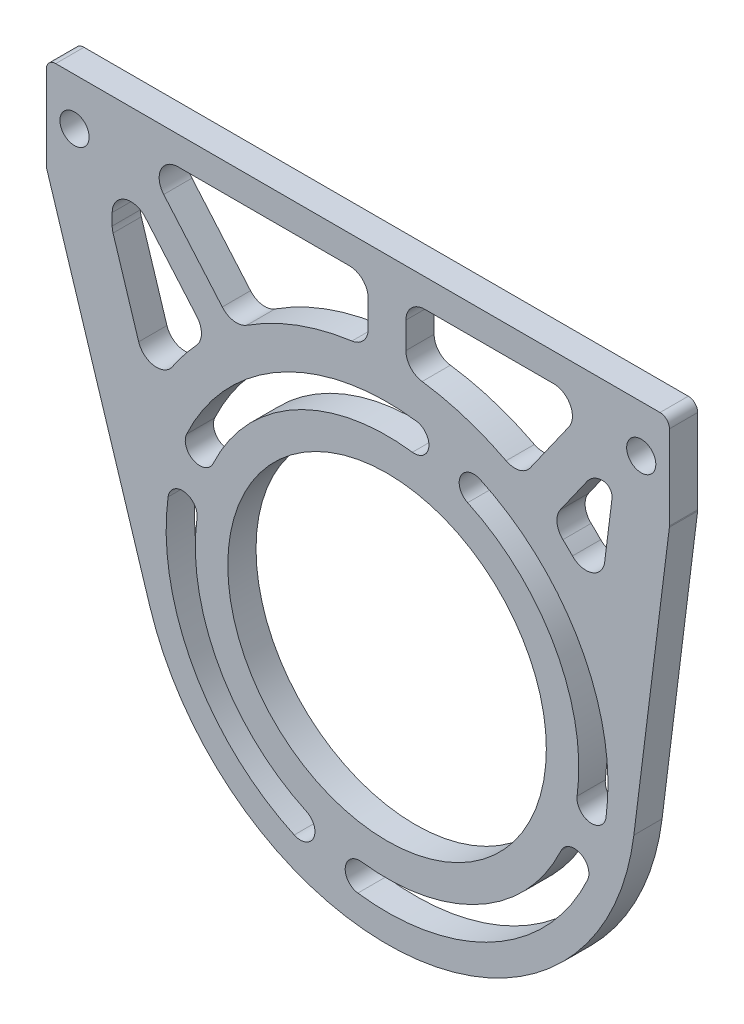
from build123d import *

# Parameters (mm, degrees)
SKETCH_1_R          = 1.55
SKETCH_1_R_2        = 26.42
SKETCH_1_R_3        = 16.92
EXTRUDE_1_DEPTH     = 3
CUT_EXTRUDE_1_DEPTH = 3
FILLET_2_R          = 2
FILLET_3_R          = 1
FILLET_4_R          = 1


with BuildPart() as part:
    # 草图1 → 凸台-拉伸1 (new body)
    # profile 1 of 2: a face of its own
    with BuildSketch(Plane.XY):
        with BuildLine():
            Line((30, 37), (-36.2, 37))
            Line((-36.2, 37), (-36.2, 27))
            Line((-36.2, 27), (-25.200345341, -7.93467042))
            ThreePointArc((-25.200345341, -7.93467042), (-4.013930498, 26.113306224), (26.42, 0))
            ThreePointArc((26.42, 0), (26.368962228, -1.641411281), (26.216046102, -3.276480854))
            Line((26.216046102, -3.276480854), (30, 27))
            Line((30, 27), (30, 37))
        make_face()
        with Locations((-33.2, 32)):
            Circle(SKETCH_1_R, mode=Mode.SUBTRACT)
        with Locations((27, 32)):
            Circle(SKETCH_1_R, mode=Mode.SUBTRACT)
    # profile 2 of 2: a face of its own
    with BuildSketch(Plane.XY):
        Circle(SKETCH_1_R_2)
        Circle(SKETCH_1_R_3, mode=Mode.SUBTRACT)
        with BuildLine():
            ThreePointArc((-23.263933046, 3.103275567), (-20.571496751, -11.298425617), (-9.862515799, -21.297222404))
            ThreePointArc((-9.862515799, -21.297222404), (-7.804671989, -20.542054307), (-8.559840086, -18.484210497))
            ThreePointArc((-8.559840086, -18.484210497), (-17.854341236, -9.806089894), (-20.191151092, 2.693384035))
            ThreePointArc((-20.191151092, 2.693384035), (-21.522596303, 4.434720778), (-23.263933046, 3.103275567))
        make_face(mode=Mode.SUBTRACT)
        with BuildLine():
            ThreePointArc((-3.103275567, -23.263933046), (11.298425617, -20.571496751), (21.297222404, -9.862515799))
            ThreePointArc((21.297222404, -9.862515799), (20.542054307, -7.804671989), (18.484210497, -8.559840086))
            ThreePointArc((18.484210497, -8.559840086), (9.806089894, -17.854341236), (-2.693384035, -20.191151092))
            ThreePointArc((-2.693384035, -20.191151092), (-4.434720778, -21.522596303), (-3.103275567, -23.263933046))
        make_face(mode=Mode.SUBTRACT)
        with BuildLine():
            ThreePointArc((23.263933046, -3.103275567), (20.571496751, 11.298425617), (9.862515799, 21.297222404))
            ThreePointArc((9.862515799, 21.297222404), (7.804671989, 20.542054307), (8.559840086, 18.484210497))
            ThreePointArc((8.559840086, 18.484210497), (17.854341236, 9.806089894), (20.191151092, -2.693384035))
            ThreePointArc((20.191151092, -2.693384035), (21.522596303, -4.434720778), (23.263933046, -3.103275567))
        make_face(mode=Mode.SUBTRACT)
        with BuildLine():
            ThreePointArc((3.103275567, 23.263933046), (-11.298425617, 20.571496751), (-21.297222404, 9.862515799))
            ThreePointArc((-21.297222404, 9.862515799), (-20.542054307, 7.804671989), (-18.484210497, 8.559840086))
            ThreePointArc((-18.484210497, 8.559840086), (-9.806089894, 17.854341236), (2.693384035, 20.191151092))
            ThreePointArc((2.693384035, 20.191151092), (4.434720778, 21.522596303), (3.103275567, 23.263933046))
        make_face(mode=Mode.SUBTRACT)
    extrude(amount=EXTRUDE_1_DEPTH)

    # 草图2 → 切除-拉伸1 (cut)
    with BuildSketch(Plane.XY.offset(3)):
        with BuildLine():
            Line((-19.008658137, 19.831082064), (-29.2, 31.697713001))
            Line((-29.2, 31.697713001), (-29.2, 24.746293615))
            Line((-29.2, 24.746293615), (-24.995728208, 11.393615376))
            ThreePointArc((-24.995728208, 11.393615376), (-22.40299568, 15.896750755), (-19.008658137, 19.831082064))
        make_face()
        with BuildLine():
            Line((-2, 34), (-26.563655671, 34))
            Line((-26.563655671, 34), (-16.332670153, 22.087208643))
            ThreePointArc((-16.332670153, 22.087208643), (-9.543082634, 25.759085268), (-2, 27.397096561))
            Line((-2, 27.397096561), (-2, 34))
        make_face()
        with BuildLine():
            Line((2, 34), (2, 27.397096561))
            ThreePointArc((2, 27.397096561), (8.310120791, 26.18287212), (14.165509523, 23.535913833))
            Line((14.165509523, 23.535913833), (21.551923289, 34))
            Line((21.551923289, 34), (2, 34))
        make_face()
        with BuildLine():
            ThreePointArc((17.364100225, 21.285885544), (20.1471001, 18.673383667), (22.541088548, 15.7003257))
            Line((22.541088548, 15.7003257), (24, 27.373487117))
            Line((24, 27.373487117), (24, 30.686743559))
            Line((24, 30.686743559), (17.364100225, 21.285885544))
        make_face()
    extrude(amount=-CUT_EXTRUDE_1_DEPTH, mode=Mode.SUBTRACT)

    # 圆角2
    # the kernel refuses this fillet: 2 mm, written as the material it adds along each edge
    with BuildSketch(Plane(origin=(-24.995728208, 11.393615376, 3), x_dir=(-0.30032817640005316, 0.9538359326740729, 0), z_dir=(0, 0, -1))) as fillet_2_piece_1:
        with BuildLine():
            CenterArc((4.629449301, 2), FILLET_2_R, 141.314699256, 128.685300744)
            Line((3.068267725, 3.250084832), (3.037044093, 3.275086529))
            ThreePointArc((3.037044093, 3.275086529), (1.571259467, 1.589993702), (-0.026755823, 0.029734256))
            Line((-0.026755823, 0.029734256), (0, -0.04))
            Line((0, -0.04), (4.629449301, -0.04))
            Line((4.629449301, -0.04), (4.629449301, 0))
        make_face()
    extrude(amount=3)
    with BuildSketch(Plane(origin=(-29.2, 31.697713001, 3), x_dir=(0.6515260697252437, -0.7586262455704896, 0), z_dir=(0, 0, -1))) as fillet_2_piece_2:
        with BuildLine():
            CenterArc((FILLET_2_R * 2.69924156114, FILLET_2_R), FILLET_2_R, 130.656760048, 139.343239952)
            Line((FILLET_2_R * 2.04771549142, FILLET_2_R * 1.75862624557), (FILLET_2_R * 2.03468497002, FILLET_2_R * 1.77379877048))
            Line((FILLET_2_R * 2.03468497002, FILLET_2_R * 1.77379877048), (-FILLET_2_R * 0.0130305213945, FILLET_2_R * 0.0151725249114))
            Line((-FILLET_2_R * 0.0130305213945, FILLET_2_R * 0.0151725249114), (0, -FILLET_2_R * 0.02))
            Line((0, -FILLET_2_R * 0.02), (FILLET_2_R * 2.69924156114, -FILLET_2_R * 0.02))
            Line((FILLET_2_R * 2.69924156114, -FILLET_2_R * 0.02), (FILLET_2_R * 2.69924156114, 0))
        make_face()
    extrude(amount=3)
    with BuildSketch(Plane(origin=(-19.008658137, 19.831082064, 3), x_dir=(-0.6515260697252421, 0.758626245570491, 0), z_dir=(0, 0, -1))) as fillet_2_piece_3:
        with BuildLine():
            CenterArc((1.832407752, -2), FILLET_2_R, 90, 83.179176321)
            Line((-0.153437067, -1.762470309), (-0.193153964, -1.757719715))
            ThreePointArc((-0.193153964, -1.757719715), (-0.102375692, -0.879001495), (-0.039940321, 0.002184201))
            Line((-0.039940321, 0.002184201), (0, 0.04))
            Line((0, 0.04), (1.832407752, 0.04))
            Line((1.832407752, 0.04), (1.832407752, 0))
        make_face()
    extrude(amount=3)
    with BuildSketch(Plane(origin=(-29.2, 24.746293615, 3), x_dir=(0, 1, 0), z_dir=(0, 0, -1))) as fillet_2_piece_4:
        with BuildLine():
            CenterArc((FILLET_2_R * 0.153712075501, FILLET_2_R), FILLET_2_R, 252.522684781, 17.477315219)
            Line((-FILLET_2_R * 0.146616100899, FILLET_2_R * 0.0461640673259), (-FILLET_2_R * 0.152622664427, FILLET_2_R * 0.0270873486724))
            Line((-FILLET_2_R * 0.152622664427, FILLET_2_R * 0.0270873486724), (-FILLET_2_R * 0.00307424151002, -FILLET_2_R * 0.02))
            Line((-FILLET_2_R * 0.00307424151002, -FILLET_2_R * 0.02), (FILLET_2_R * 0.153712075501, -FILLET_2_R * 0.02))
            Line((FILLET_2_R * 0.153712075501, -FILLET_2_R * 0.02), (FILLET_2_R * 0.153712075501, 0))
        make_face()
    extrude(amount=3)
    with BuildSketch(Plane(origin=(24, 30.686743559, 3), x_dir=(0, -1, 0), z_dir=(0, 0, -1))) as fillet_2_piece_5:
        with BuildLine():
            CenterArc((4.997060807, 1.079260329), FILLET_2_R, 125.217592968, 87.440873122)
            Line((3.843694412, 2.713196056), (3.820627084, 2.74587477))
            Line((3.820627084, 2.74587477), (-0.023067328, 0.032678715))
            Line((-0.023067328, 0.032678715), (0, -0.04))
            ThreePointArc((0, -0.04), (1.656628221, -0.04), (3.279580354, -0.021585207))
            Line((3.279580354, -0.021585207), (3.313256441, 0))
        make_face()
    extrude(amount=3)
    with BuildSketch(Plane(origin=(22.541088548, 15.7003257, 3), x_dir=(-0.6364068134121097, 0.7713535945613038, 0), z_dir=(0, 0, -1))) as fillet_2_piece_6:
        with BuildLine():
            CenterArc((4.632307724, 1.993370508), FILLET_2_R, 136.64829025, 128.685300744)
            Line((3.17800071, 3.366320293), (3.14891457, 3.393779288))
            Line((3.14891457, 3.393779288), (-0.02908614, 0.027458996))
            Line((-0.02908614, 0.027458996), (0.003254168, -0.03986741))
            ThreePointArc((0.003254168, -0.03986741), (2.234799669, 0.051056075), (4.466345171, -0.03986741))
            Line((4.466345171, -0.03986741), (4.469599338, 0))
        make_face()
    extrude(amount=3)
    with BuildSketch(Plane(origin=(17.364100225, 21.285885544, 3), x_dir=(0.7544268815808631, -0.6563840951365095, 0), z_dir=(0, 0, -1))) as fillet_2_piece_7:
        with BuildLine():
            CenterArc((1.80701637, -1.998992608), FILLET_2_R, 91.818612545, 82.374297542)
            Line((-0.182720022, -1.796633797), (-0.22251475, -1.792586621))
            Line((-0.22251475, -1.792586621), (-0.039794728, 0.004047176))
            Line((-0.039794728, 0.004047176), (0.001269418, 0.039979852))
            ThreePointArc((0.001269418, 0.039979852), (0.871772738, 0.026163466), (1.742276058, 0.039979852))
            Line((1.742276058, 0.039979852), (1.743545476, 0))
        make_face()
    extrude(amount=3)
    with BuildSketch(Plane(origin=(2, 27.397096561, 3), x_dir=(0.9945436589558404, -0.10432118879081512, 0), z_dir=(0, 0, -1)), Plane(origin=(-16.332670153, 22.087208643, 3), x_dir=(0.8224548961715518, 0.5688303295038354, 0), z_dir=(0, 0, -1))) as fillet_2_piece_8:
        with BuildLine():
            CenterArc((1.801290505, -1.998998983), FILLET_2_R, 91.812848009, 82.19909323)
            Line((-0.187796813, -1.790356606), (-0.227578559, -1.786183758))
            Line((-0.227578559, -1.786183758), (-0.039781746, 0.004172848))
            Line((-0.039781746, 0.004172848), (0.001265396, 0.03997998))
            ThreePointArc((0.001265396, 0.03997998), (0.869010365, 0.026251037), (1.736755334, 0.03997998))
            Line((1.736755334, 0.03997998), (1.73802073, 0))
        make_face()
    extrude(amount=3)
    with BuildSketch(Plane(origin=(21.551923289, 34, 3), x_dir=(-0.576683197598655, -0.8169678632647618, 0), z_dir=(0, 0, -1))) as fillet_2_piece_9:
        with BuildLine():
            CenterArc((FILLET_2_R * 1.92992070863, FILLET_2_R), FILLET_2_R, 144.782407032, 125.217592968)
            Line((FILLET_2_R * 1.11295284536, FILLET_2_R * 1.5766831976), (FILLET_2_R * 1.0966134881, FILLET_2_R * 1.58821686155))
            Line((FILLET_2_R * 1.0966134881, FILLET_2_R * 1.58821686155), (-FILLET_2_R * 0.0163393572653, FILLET_2_R * 0.011533663952))
            Line((-FILLET_2_R * 0.0163393572653, FILLET_2_R * 0.011533663952), (0, -FILLET_2_R * 0.02))
            Line((0, -FILLET_2_R * 0.02), (FILLET_2_R * 1.92992070863, -FILLET_2_R * 0.02))
            Line((FILLET_2_R * 1.92992070863, -FILLET_2_R * 0.02), (FILLET_2_R * 1.92992070863, 0))
        make_face()
    extrude(amount=3)
    with BuildSketch(Plane(origin=(14.165509523, 23.535913833, 3), x_dir=(-0.8726704847098519, 0.4883095586984472, 0), z_dir=(0, 0, -1)), Plane(origin=(-2, 27.397096561, 3), x_dir=(-0.9945436589558406, -0.10432118879081306, 0), z_dir=(0, 0, -1))) as fillet_2_piece_10:
        with BuildLine():
            CenterArc((1.801290505, 1.998998983), FILLET_2_R, 185.988058762, 82.19909323)
            Line((-0.187796813, 1.790356606), (-0.227578559, 1.786183758))
            Line((-0.227578559, 1.786183758), (-0.039781746, -0.004172848))
            Line((-0.039781746, -0.004172848), (0.001265396, -0.03997998))
            ThreePointArc((0.001265396, -0.03997998), (0.869010365, -0.026251037), (1.736755334, -0.03997998))
            Line((1.736755334, -0.03997998), (1.73802073, 0))
        make_face()
    extrude(amount=3)
    with BuildSketch(Plane(origin=(2, 34, 3), x_dir=(1, 0, 0), z_dir=(0, 0, -1)), Plane(origin=(-2, 34, 3), x_dir=(0, -1, 0), z_dir=(0, 0, -1))) as fillet_2_piece_11:
        with BuildLine():
            CenterArc((FILLET_2_R, FILLET_2_R), FILLET_2_R, 180, 90)
            Line((0, FILLET_2_R), (-FILLET_2_R * 0.02, FILLET_2_R))
            Line((-FILLET_2_R * 0.02, FILLET_2_R), (-FILLET_2_R * 0.02, -FILLET_2_R * 0.02))
            Line((-FILLET_2_R * 0.02, -FILLET_2_R * 0.02), (FILLET_2_R, -FILLET_2_R * 0.02))
            Line((FILLET_2_R, -FILLET_2_R * 0.02), (FILLET_2_R, 0))
        make_face()
    extrude(amount=3)
    with BuildSketch(Plane(origin=(-26.563655671, 34, 3), x_dir=(1, 0, 0), z_dir=(0, 0, -1))) as fillet_2_piece_12:
        with BuildLine():
            CenterArc((FILLET_2_R * 2.17699569369, FILLET_2_R), FILLET_2_R, 139.343239952, 130.656760048)
            Line((FILLET_2_R * 1.41836944812, FILLET_2_R * 1.65152606973), (FILLET_2_R * 1.40319692321, FILLET_2_R * 1.66455659112))
            Line((FILLET_2_R * 1.40319692321, FILLET_2_R * 1.66455659112), (-FILLET_2_R * 0.0151725249114, FILLET_2_R * 0.0130305213945))
            Line((-FILLET_2_R * 0.0151725249114, FILLET_2_R * 0.0130305213945), (0, -FILLET_2_R * 0.02))
            Line((0, -FILLET_2_R * 0.02), (FILLET_2_R * 2.17699569369, -FILLET_2_R * 0.02))
            Line((FILLET_2_R * 2.17699569369, -FILLET_2_R * 0.02), (FILLET_2_R * 2.17699569369, 0))
        make_face()
    extrude(amount=3)

    # 圆角3
    fillet_3_edges = [part.edges().sort_by_distance(p)[0] for p in [
        (24, 27.373487117, 1.5),
    ]]
    fillet(fillet_3_edges, radius=FILLET_3_R)

    # 圆角4
    fillet_4_edges = [part.edges().sort_by_distance(p)[0] for p in [
        (-36.2, 27, 1.5),
        (-36.2, 37, 1.5),
        (30, 37, 1.5),
        (30, 27, 1.5),
    ]]
    fillet(fillet_4_edges, radius=FILLET_4_R)


solid = part.part
